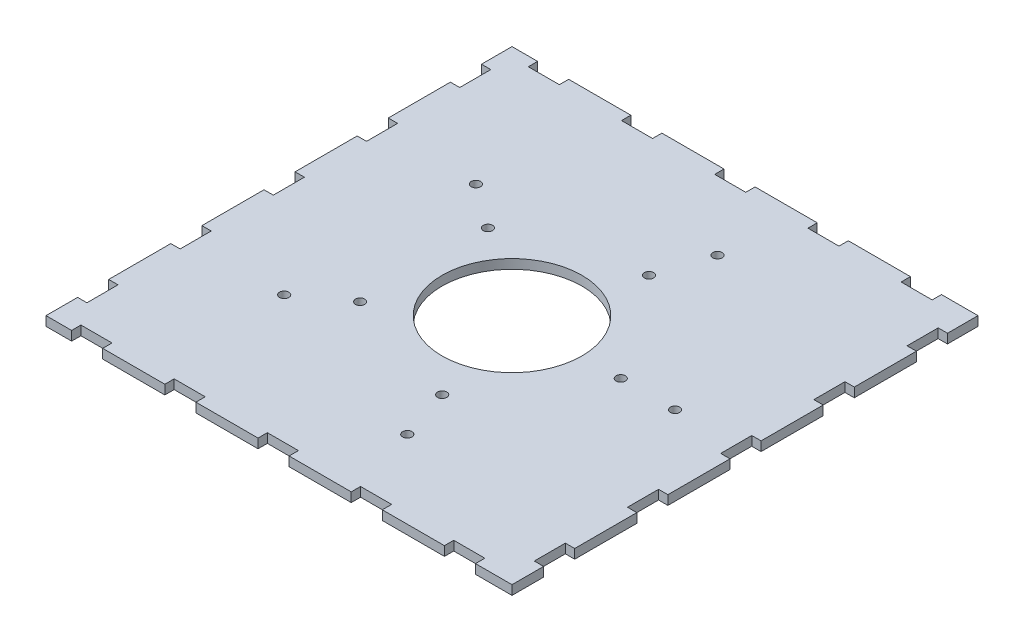
from build123d import *

# Parameters (mm, degrees)
SKETCH1_W           = 150
SKETCH1_H           = 150
BOSS_EXTRUDE1_DEPTH = 3
SKETCH2_R           = 22.5
CUT_EXTRUDE1_DEPTH  = 3
SKETCH3_W           = 10
SKETCH3_H           = 3
CUT_EXTRUDE2_DEPTH  = 3
LPATTERN1_COUNT     = 5
LPATTERN1_PITCH     = 30
SKETCH4_W           = 3
SKETCH4_H           = 10
CUT_EXTRUDE3_DEPTH  = 3
LPATTERN2_COUNT     = 5
LPATTERN2_PITCH     = 30
SKETCH5_R           = 1.5
CUT_EXTRUDE5_DEPTH  = 3
SKETCH5_3_R         = 1.5
CUT_EXTRUDE6_DEPTH  = 3


with BuildPart() as part:
    # Sketch1 → Boss-Extrude1 (new body)
    with BuildSketch(Plane(origin=(0, 0, 0), x_dir=(-1, 0, 0), z_dir=(0, 1, 0))):
        Rectangle(SKETCH1_W, SKETCH1_H)
    extrude(amount=BOSS_EXTRUDE1_DEPTH)

    # Sketch2 → Cut-Extrude1 (cut)
    with BuildSketch(Plane(origin=(0, 3, 0), x_dir=(1, 0, 0), z_dir=(0, 1, 0))):
        Circle(SKETCH2_R)
    extrude(amount=-CUT_EXTRUDE1_DEPTH, mode=Mode.SUBTRACT)

    # Sketch3 → Cut-Extrude2 (cut)
    with BuildSketch(Plane(origin=(0, 3, 0), x_dir=(1, 0, 0), z_dir=(0, 1, 0))):
        with Locations((-61.749963879, 73.5)):
            Rectangle(SKETCH3_W, SKETCH3_H)
        with Locations((-61.749963879, -73.5)):
            Rectangle(SKETCH3_W, SKETCH3_H)
    cut_extrude2 = extrude(amount=-CUT_EXTRUDE2_DEPTH, mode=Mode.SUBTRACT)

    # LPattern1: Cut-Extrude2 ×5
    with Locations(*[(i * LPATTERN1_PITCH, 0, 0) for i in range(1, LPATTERN1_COUNT)]):
        add(cut_extrude2, mode=Mode.SUBTRACT)

    # Sketch4 → Cut-Extrude3 (cut)
    with BuildSketch(Plane(origin=(0, 3, 0), x_dir=(1, 0, 0), z_dir=(0, 1, 0))):
        with Locations((-73.5, -59.825317059)):
            Rectangle(SKETCH4_W, SKETCH4_H)
        with Locations((73.5, -59.825317059)):
            Rectangle(SKETCH4_W, SKETCH4_H)
    cut_extrude3 = extrude(amount=-CUT_EXTRUDE3_DEPTH, mode=Mode.SUBTRACT)

    # LPattern2: Cut-Extrude3 ×5
    with Locations(*[(0, 0, -i * LPATTERN2_PITCH) for i in range(1, LPATTERN2_COUNT)]):
        add(cut_extrude3, mode=Mode.SUBTRACT)

    # Sketch5 → Cut-Extrude5 (cut)
    with BuildSketch(Plane(origin=(0, 0, 0), x_dir=(-1, 0, 0), z_dir=(0, -1, 0))):
        with Locations((-35, 0)):
            Circle(SKETCH5_R)
    extrude(amount=-CUT_EXTRUDE5_DEPTH, mode=Mode.SUBTRACT)

    # Sketch5<3> → Cut-Extrude6 (cut)
    with BuildSketch(Plane(origin=(0, 0, 0), x_dir=(-1, 0, 0), z_dir=(0, -1, 0))):
        with Locations((-35, 0)):
            Circle(SKETCH5_3_R)
        with Locations((-52.5, 0)):
            Circle(SKETCH5_3_R)
        with Locations((-10.815594803, 33.28697807)):
            Circle(SKETCH5_3_R)
        with Locations((28.315594803, 20.57248383)):
            Circle(SKETCH5_3_R)
        with Locations((28.315594803, -20.57248383)):
            Circle(SKETCH5_3_R)
        with Locations((-10.815594803, -33.28697807)):
            Circle(SKETCH5_3_R)
        with Locations((-16.223392205, 49.930467105)):
            Circle(SKETCH5_3_R)
        with Locations((42.473392205, 30.858725745)):
            Circle(SKETCH5_3_R)
        with Locations((42.473392205, -30.858725745)):
            Circle(SKETCH5_3_R)
        with Locations((-16.223392205, -49.930467105)):
            Circle(SKETCH5_3_R)
    extrude(amount=-CUT_EXTRUDE6_DEPTH, mode=Mode.SUBTRACT)


solid = part.part
